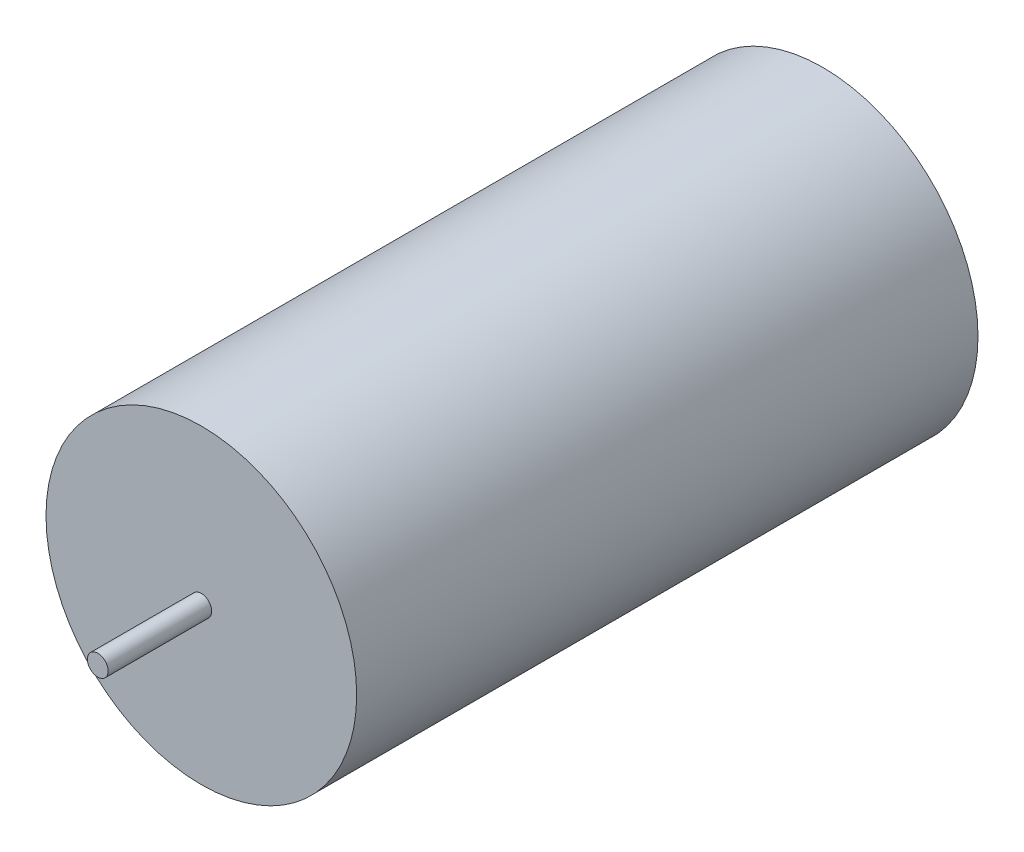
from build123d import *

# Parameters (mm, degrees)
SKETCH1_R           = 19.05
BOSS_EXTRUDE1_DEPTH = 76.2
SKETCH2_R           = 1.27
BOSS_EXTRUDE2_DEPTH = 12.7


with BuildPart() as part:
    # Sketch1 → Boss-Extrude1 (new body)
    with BuildSketch(Plane.XY):
        with Locations((0, -25.4)):
            Circle(SKETCH1_R)
    extrude(amount=-BOSS_EXTRUDE1_DEPTH)

    # Sketch2 → Boss-Extrude2 (add)
    with BuildSketch(Plane.XY):
        with Locations((0, -25.4)):
            Circle(SKETCH2_R)
    extrude(amount=BOSS_EXTRUDE2_DEPTH)


solid = part.part
